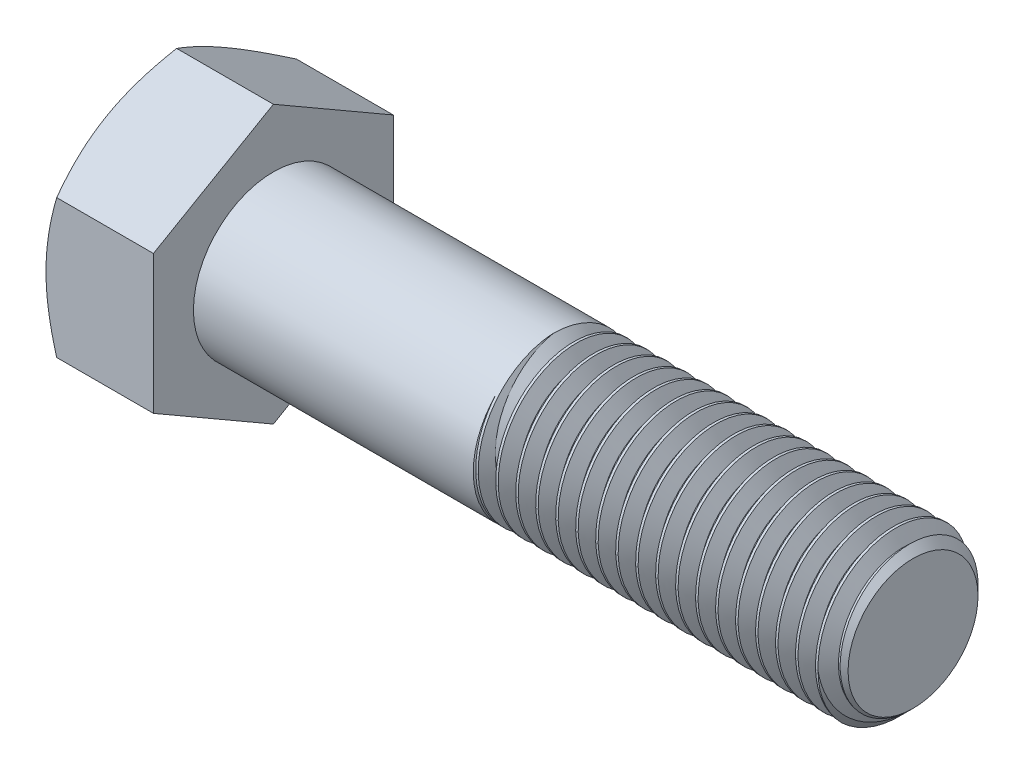
from build123d import *

# Parameters (mm, degrees)
SKETCH5_R           = 12.7
BOSS_EXTRUDE3_DEPTH = 101.6
CHAMFER1_SIZE       = 2.38125
CUT_SWEEP1_PITCH    = 3.175
BOSS_EXTRUDE4_DEPTH = 17.065625
SKETCH8_OUTSIDE_W   = 493.246
SKETCH8_OUTSIDE_H   = 499.14
SKETCH8_OUTSIDE_R   = 19.05
CUT_EXTRUDE3_DEPTH  = 123.181435089
CUT_EXTRUDE3_DRAFT  = -60
CUT_EXTRUDE4_DEPTH  = 0.254
CIRPATTERN1_COUNT   = 3


with BuildPart() as part:
    # Sketch5 → Boss-Extrude3 (new body)
    with BuildSketch(Plane(origin=(59.3328125, 0, 0), x_dir=(0, 0, -1), z_dir=(1, 0, 0))):
        Circle(SKETCH5_R)
    extrude(amount=-BOSS_EXTRUDE3_DEPTH)

    # Chamfer1
    chamfer1_edges = [part.edges().sort_by_distance(p)[0] for p in [
        (59.3328125, 0, 12.7),
    ]]
    chamfer(chamfer1_edges, length=CHAMFER1_SIZE)

    # Cut-Sweep1: the profile of Sketch10 profile screwed along a right-hand helix of 19 turns, 12 arcs to a turn; built about Z, then put on its axis
    cut_sweep1_z = Axis((0, 0, 0), (0, 0, 1))
    cut_sweep1_corners = [(12.7003, 0, 0.000173205), (10.637777007, 0, -1.190625), (10.637777007, 0, -1.5875), (12.7003, 0, -2.778298205)]
    with BuildLine(mode=Mode.PRIVATE) as cut_sweep1_profile:
        Line(cut_sweep1_corners[0], cut_sweep1_corners[1])
        Line(cut_sweep1_corners[1], cut_sweep1_corners[2])
        Line(cut_sweep1_corners[2], cut_sweep1_corners[3])
        Line(cut_sweep1_corners[3], cut_sweep1_corners[0])
    cut_sweep1_cap = Face(cut_sweep1_profile.wire())
    cut_sweep1_turn_angles = [0, 15, 30, 45, 60, 75, 90, 105, 120, 135, 150, 165, 180, 195, 210, 225, 240, 255, 270, 285, 300, 315, 330, 345, 360]
    cut_sweep1_turn_weights = [1, 0.9659258262890683, 1, 0.9659258262890683, 1, 0.9659258262890683, 1, 0.9659258262890683, 1, 0.9659258262890683, 1, 0.9659258262890683, 1, 0.9659258262890683, 1, 0.9659258262890683, 1, 0.9659258262890683, 1, 0.9659258262890683, 1, 0.9659258262890683, 1, 0.9659258262890683, 1]
    cut_sweep1_turn_rails = [Edge.make_bspline([Vector(p[0], p[1], 0).rotate(cut_sweep1_z, cut_sweep1_turn_angles[k]) / cut_sweep1_turn_weights[k] + Vector(0, 0, p[2] + CUT_SWEEP1_PITCH * cut_sweep1_turn_angles[k] / 360) for k in range(25)], [0, 0, 0, 1, 1, 2, 2, 3, 3, 4, 4, 5, 5, 6, 6, 7, 7, 8, 8, 9, 9, 10, 10, 11, 11, 12, 12, 12], 2, cut_sweep1_turn_weights) for p in cut_sweep1_corners]
    cut_sweep1_turn_sides = [Face.make_surface_from_curves(cut_sweep1_turn_rails[p[0]], cut_sweep1_turn_rails[p[1]]) for p in [(0, 1), (1, 2), (2, 3), (3, 0)]]
    cut_sweep1 = Plane(origin=(59.3328125, 0, 0), x_dir=(0, 1, 0), z_dir=(-1, 0, 0)) * Solid(Shell([*[p.moved(Location((0, 0, CUT_SWEEP1_PITCH * i))) for i in range(19) for p in cut_sweep1_turn_sides], cut_sweep1_cap, cut_sweep1_cap.rotate(cut_sweep1_z, 6840).moved(Location((0, 0, CUT_SWEEP1_PITCH * 6840 / 360)))]))
    add(cut_sweep1, mode=Mode.SUBTRACT)

    # Sketch11 → Revolve1 (revolve)
    with BuildSketch(Plane.XY, mode=Mode.PRIVATE) as revolve1_sk:
        Polygon((-42.2671875, 12.7), (-42.2671875, 0), (14.8828125, 0), (2.1828125, 12.7), align=None)
    revolve(revolve1_sk.sketch.rotate(Axis((-42.2671875, 0, 0), (1, 0, 0)), 270), axis=Axis((-42.2671875, 0, 0), (1, 0, 0)))

    # Sketch6 → Boss-Extrude4 (add)
    with BuildSketch(Plane.ZY.offset(42.2671875)):
        Polygon((19.05, 10.998522628), (0, 21.997045256), (-19.05, 10.998522628), (-19.05, -10.998522628), (0, -21.997045256), (19.05, -10.998522628), align=None)
    extrude(amount=BOSS_EXTRUDE4_DEPTH)


with BuildPart() as cut_extrude3_tool:
    # Sketch8 outside → Cut-Extrude3 (with draft: the straight prism first)
    with BuildSketch(Plane.ZY.offset(59.3328125)):
        Rectangle(SKETCH8_OUTSIDE_W, SKETCH8_OUTSIDE_H)
        Circle(SKETCH8_OUTSIDE_R, mode=Mode.SUBTRACT)
    extrude(amount=-CUT_EXTRUDE3_DEPTH)
    # Cut-Extrude3: the draft: its side faces are tilted about the plane it starts from
    cut_extrude3_sides = [cut_extrude3_tool.faces().sort_by_distance(p)[0] for p in [
        (2.257905044, -249.57, 0),
        (2.257905044, 0, 246.623),
        (2.257905044, 249.57, 0),
        (2.257905044, 0, -246.623),
        (2.257905044, 0, -19.05),
    ]]
    draft(cut_extrude3_sides, Plane.ZY.offset(59.3328125), CUT_EXTRUDE3_DRAFT)


with BuildPart() as part_1:
    add(part.part)

    # Cut-Extrude3: cut by cut_extrude3_tool
    add(cut_extrude3_tool.part, mode=Mode.SUBTRACT)

    # Sketch12 → Cut-Extrude4 (cut)
    with BuildSketch(Plane.ZY.offset(59.3328125)):
        with BuildLine():
            Line((0.5715, 14.6685), (0.5715, 8.1915))
            ThreePointArc((0.5715, 8.1915), (0, 7.62), (-0.5715, 8.1915))
            Line((-0.5715, 8.1915), (-0.5715, 14.6685))
            ThreePointArc((-0.5715, 14.6685), (0, 15.24), (0.5715, 14.6685))
        make_face()
    cut_extrude4 = extrude(amount=-CUT_EXTRUDE4_DEPTH, mode=Mode.SUBTRACT)

    # CirPattern1: Cut-Extrude4 ×3 about axis
    cirpattern1_axis = Axis((0, 0, 0), (1, 0, 0))
    for i in range(1, CIRPATTERN1_COUNT):
        add(cut_extrude4.rotate(cirpattern1_axis, i * 360 / CIRPATTERN1_COUNT), mode=Mode.SUBTRACT)


solid = part_1.part
